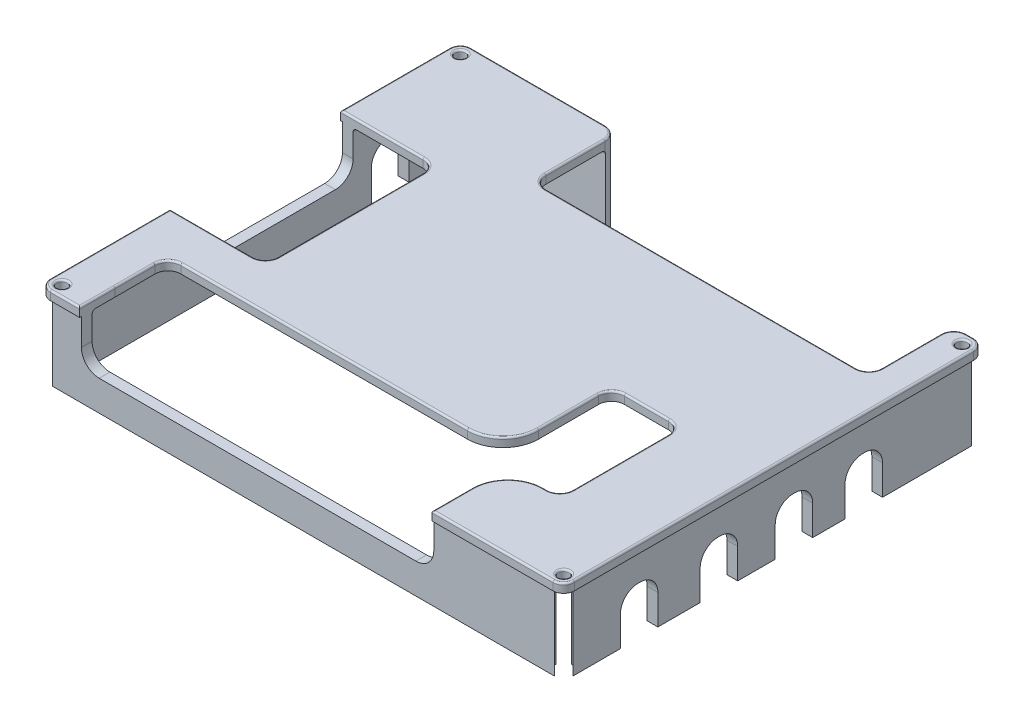
from build123d import *

# Parameters (mm, degrees)
SKETCH1_W           = 147
SKETCH1_H           = 118
BOSS_EXTRUDE1_DEPTH = 2.5
CUT_EXTRUDE1_DEPTH  = 10
BOSS_EXTRUDE2_DEPTH = 21
SKETCH6_R           = 1.4999999999999973
SKETCH6_R_2         = 1.4823605008645095
SKETCH6_R_3         = 1.484252534559789
SKETCH6_R_4         = 1.4885316900120806
CUT_EXTRUDE2_DEPTH  = 21
FILLET1_R           = 3
CUT_EXTRUDE3_DEPTH  = 3
FILLET4_R           = 4.999999999999999
SKETCH8_W           = 10.521723559696
SKETCH8_H           = 13.736523181988026
CUT_EXTRUDE4_DEPTH  = 3
FILLET5_R           = 4.999999999999999
CUT_EXTRUDE5_START  = -15
CUT_EXTRUDE5_DEPTH  = 15
FILLET6_R           = 5
FILLET7_R           = 0.5
FILLET8_R           = 1


# Read off the part's stored shape, not the designer's step: Cut-Extrude5
with BuildPart() as part:
    # Sketch1 → Boss-Extrude1 (new body)
    with BuildSketch(Plane(origin=(0, 0, 0), x_dir=(1, 0, 0), z_dir=(0, 1, 0))):
        Rectangle(SKETCH1_W, SKETCH1_H)
    extrude(amount=BOSS_EXTRUDE1_DEPTH)

    # Sketch3 → Cut-Extrude1 (cut)
    with BuildSketch(Plane(origin=(0, 2.5, 0), x_dir=(1, 0, 0), z_dir=(0, 1, 0))):
        with BuildLine():
            ThreePointArc((-32.892864533864206, 58.99999999999999), (-30.33862846902081, 57.942000780439386), (-29.280629249460205, 55.38776471559599))
            Line((-29.280629249460205, 55.38776471559599), (-29.2806292494602, 38.79021274627392))
            ThreePointArc((-29.280629249460198, 38.79021274627392), (-28.222630029899598, 36.23597668143053), (-25.668393965056207, 35.17797746186992))
            Line((-25.668393965056207, 35.17797746186992), (61.30685700718752, 35.17797746186992))
            ThreePointArc((61.30685700718752, 35.17797746186993), (63.86109307203091, 36.23597668143053), (64.91909229159151, 38.79021274627392))
            Line((64.91909229159151, 38.79021274627392), (64.91909229159151, 55.38776471559599))
            ThreePointArc((64.91909229159151, 55.38776471559599), (65.97709151115211, 57.942000780439386), (68.5313275759955, 59))
            Line((68.53132757599552, 58.99999999999999), (-32.892864533864206, 58.99999999999999))
        make_face()
        with BuildLine():
            ThreePointArc((-46.7610875562367, -18.825093847625613), (-47.81908677579731, -21.379329912468982), (-50.373322840640675, -22.437329132029586))
            Line((-50.373322840640675, -22.437329132029586), (-63.88776471559603, -22.43732913202959))
            ThreePointArc((-63.88776471559603, -22.43732913202959), (-66.44200078043941, -21.37932991246898), (-67.5, -18.825093847625592))
            Line((-67.5, -18.825093847625592), (-67.5, 21.816737731896424))
            ThreePointArc((-67.5, 21.816737731896424), (-66.4420007804394, 24.370973796739797), (-63.88776471559604, 25.42897301630042))
            Line((-63.88776471559604, 25.42897301630042), (-50.373322840640675, 25.428973016300425))
            ThreePointArc((-50.373322840640675, 25.428973016300425), (-47.8190867757973, 24.370973796739804), (-46.7610875562367, 21.816737731896424))
            Line((-46.7610875562367, 21.816737731896424), (-46.7610875562367, -18.825093847625613))
        make_face()
        with BuildLine():
            Line((35.23221749605762, -3.689694123933657), (47.5531536378178, -3.689694123933653))
            ThreePointArc((47.5531536378178, -3.689694123933653), (50.10738970266118, -4.747693343494268), (51.16538892222178, -7.301929408337653))
            Line((51.16538892222178, -7.301929408337653), (51.16538892222178, -34.12030280202387))
            ThreePointArc((51.16538892222178, -34.12030280202387), (50.10738970266135, -36.67453886686709), (47.55315363781828, -37.732538086427866))
            Line((47.55315363781828, -37.732538086427866), (46.555431638146345, -37.732538086427326))
            ThreePointArc((46.555431638146345, -37.732538086427326), (39.481945960508746, -40.66388896737662), (36.555433977376246, -47.739378012776086))
            Line((36.555433977376246, -47.739378012776086), (36.55625616412535, -48.941418085822896))
            ThreePointArc((36.55625616412535, -48.941418085822896), (35.500004270711166, -51.496377216845616), (32.9464924670362, -52.556123267571955))
            Line((32.9464924670362, -52.556123267571955), (-58.69280434770682, -52.61880388632076))
            ThreePointArc((-58.69280434770682, -52.61880388632076), (-61.24776347872955, -51.56255199290658), (-62.3075095294559, -49.00904018923161))
            Line((-62.3075095294559, -49.00904018923161), (-62.315165012113994, -37.81669618291316))
            ThreePointArc((-62.315165012113994, -37.81669618291316), (-61.25891311869982, -35.261737051890435), (-58.705401315024865, -34.201991001164075))
            Line((-58.705401315024865, -34.201991001164075), (21.626822138002403, -34.14704433912583))
            ThreePointArc((21.626822138002403, -34.14704433912583), (28.69346788929123, -31.215695797406426), (31.619982211653657, -24.14704667835571))
            Line((31.619982211653657, -24.14704667835571), (31.619982211653685, -7.301929408337654))
            ThreePointArc((31.619982211653685, -7.301929408337654), (32.67798143121427, -4.747693343494285), (35.23221749605762, -3.689694123933657))
        make_face()
    extrude(amount=-CUT_EXTRUDE1_DEPTH, mode=Mode.SUBTRACT)

    # Sketch5 → Boss-Extrude2 (add)
    with BuildSketch(Plane.XZ):
        with BuildLine():
            Line((-67.77692378864668, 55.50000000000002), (67.77692378864666, 55.50000000000002))
            ThreePointArc((67.77692378864666, 55.5), (68.39068651670148, 57.59346588560861), (70.37500000000007, 58.50000000000019))
            Line((70.37500000000007, 58.50000000000002), (-70.37499997265665, 58.50000000000001))
            ThreePointArc((-70.37499997265665, 58.50000000000007), (-68.51884468971798, 57.731155290947406), (-67.75, 55.87500000000004))
            ThreePointArc((-67.75, 55.87500000000004), (-67.7567395990083, 55.68701736091129), (-67.77692378864668, 55.50000000000006))
        make_face()
        with BuildLine():
            Line((-70.00000000000001, -53.27692378864652), (-70, 53.276923788646684))
            ThreePointArc((-70.00000000000006, 53.27692378864669), (-72.0934658856085, 53.890686516701585), (-73.00000000000006, 55.87500000000004))
            Line((-73.00000000000001, 55.87500000000004), (-72.99999999999999, -55.87499999999988))
            ThreePointArc((-73.00000000000003, -55.87499999999988), (-72.09346588560848, -53.890686516701436), (-70.00000000000006, -53.27692378864653))
        make_face()
        with BuildLine():
            ThreePointArc((72.99999999999994, 55.87500000000019), (72.0934658856084, 53.89068651670175), (69.99999999999996, 53.27692378864687))
            Line((70, 53.276923788646876), (70, -53.27692378864658))
            ThreePointArc((69.99999999999994, -53.27692378864657), (72.09346588560838, -53.89068651670145), (72.99999999999993, -55.87499999999989))
            Line((73, -55.87499999999989), (73.00000000000001, 55.87500000000019))
        make_face()
        with BuildLine():
            Line((-29.282373294319655, -55.499999999999964), (-67.77692378864663, -55.499999999999964))
            ThreePointArc((-67.77692378864664, -55.5), (-67.75673959900827, -55.687017360911184), (-67.74999999999997, -55.87499999999988))
            ThreePointArc((-67.74999999999997, -55.87499999999988), (-68.5188446993853, -57.73115530061459), (-70.375, -58.49999999999991))
            Line((-70.375, -58.499999999999986), (-31.059224633446632, -58.49999999999998))
            ThreePointArc((-31.059224633446615, -58.50000000000004), (-29.78486823925952, -57.22858050828593), (-29.282373294319648, -55.50000000000002))
        make_face()
        with BuildLine():
            ThreePointArc((70.37499999999991, -58.49999999999989), (68.39068651670149, -57.593465885608346), (67.7769237886466, -55.49999999999994))
            Line((67.7769237886466, -55.499999999999964), (64.92083633645096, -55.499999999999964))
            ThreePointArc((64.92083633645095, -55.50000000000002), (65.42333128139083, -57.22858050828592), (66.69768767557792, -58.500000000000036))
            Line((66.69768767557794, -58.49999999999997), (70.37499999999991, -58.49999999999997))
        make_face()
    extrude(amount=BOSS_EXTRUDE2_DEPTH)

    # Sketch6 → Cut-Extrude2 (cut)
    with BuildSketch(Plane(origin=(0, 2.5, 0), x_dir=(1, 0, 0), z_dir=(0, 1, 0))):
        with Locations(Location((70.37499999999949, 55.87500000000038, 0), (0, 0, 270))):
            Circle(SKETCH6_R)
        with Locations(Location((-70.37500000000044, 55.87500000000036, 0), (0, 0, 270))):
            Circle(SKETCH6_R_2)
        with Locations(Location((-70.37500000000047, -55.87499999999959, 0), (0, 0, 270))):
            Circle(SKETCH6_R_3)
        with Locations(Location((70.37499999999943, -55.874999999999666, 0), (0, 0, 270))):
            Circle(SKETCH6_R_4)
    extrude(amount=-CUT_EXTRUDE2_DEPTH, mode=Mode.SUBTRACT)

    # Fillet1
    fillet1_edges = [part.edges().sort_by_distance(p)[0] for p in [
        (73.49999999999999, 1.25, 59.000000000000014),
        (-73.50000000000001, 1.25, 59.000000000000014),
        (-73.50000000000001, 1.25, -58.99999999999999),
        (73.49999999999999, 1.25, -58.99999999999999),
    ]]
    fillet(fillet1_edges, radius=FILLET1_R)

    # Sketch7 → Cut-Extrude3 (cut)
    with BuildSketch(Plane(origin=(73, 0, -8.66e-15), x_dir=(-1.2e-16, 0, -1), z_dir=(1, 0, -1.2e-16))):
        Polygon((-42.59267980525678, -21), (-32.070956245560794, -21), (-32.070956245560794, -7.599100826531567), (-42.592679805256786, -7.599100826531567), align=None)
        Polygon((-20.2071080106505, -21), (-9.685384450954516, -21), (-9.68538445095451, -7.599100826531567), (-20.20710801065051, -7.599100826531567), align=None)
        Polygon((0.841229023424134, -21), (11.362952583120133, -21), (11.362952583120132, -7.599100826531567), (0.8412290234241366, -7.599100826531567), align=None)
        Polygon((20.428341210289467, -21), (30.950064769985463, -21), (30.950064769985463, -7.599100826531605), (20.428341210289467, -7.599100826531567), align=None)
    extrude(amount=-CUT_EXTRUDE3_DEPTH, mode=Mode.SUBTRACT)

    # Fillet4
    fillet4_edges = [part.edges().sort_by_distance(p)[0] for p in [
        (71.5, -7.599100826531567, 32.07095624556079),
        (71.5, -7.599100826531567, 42.59267980525678),
        (71.5, -7.599100826531567, 9.685384450954501),
        (71.5, -7.599100826531567, 20.207108010650504),
        (71.5, -7.599100826531567, -11.362952583120142),
        (71.5, -7.599100826531567, -0.8412290234241451),
        (71.5, -7.599100826531605, -30.95006476998547),
        (71.5, -7.599100826531567, -20.428341210289474),
    ]]
    fillet(fillet4_edges, radius=FILLET4_R)

    # Sketch8 → Cut-Extrude4 (cut)
    with BuildSketch(Plane.ZY.offset(73)):
        with Locations((-35.807787692210304, -14.131738409005987)):
            Rectangle(SKETCH8_W, SKETCH8_H)
    extrude(amount=-CUT_EXTRUDE4_DEPTH, mode=Mode.SUBTRACT)

    # Fillet5
    fillet5_edges = [part.edges().sort_by_distance(p)[0] for p in [
        (-71.49999999999999, -7.263476818011972, -30.546925912362322),
        (-71.49999999999999, -7.263476818011972, -41.06864947205832),
    ]]
    fillet(fillet5_edges, radius=FILLET5_R)

    # Cut-Extrude5 outline → Cut-Extrude5 (cut)
    with BuildSketch(Plane(origin=(0, 2.5, 0), x_dir=(1, 0, 0), z_dir=(0, 1, 0)).offset(CUT_EXTRUDE5_START)):
        with BuildLine():
            Line((-73.5, 25.428973016), (-73.5, -22.437329132))
            Line((-73.5, -22.437329132), (-63.887764716, -22.437329132))
            ThreePointArc((-63.887764716, -22.437329132), (-66.44200078, -21.379329912), (-67.5, -18.825093848))
            Line((-67.5, -18.825093848), (-67.5, 21.816737732))
            ThreePointArc((-67.5, 21.816737732), (-66.44200078, 24.370973796), (-63.887764716, 25.428973016))
            Line((-63.887764716, 25.428973016), (-73.5, 25.428973016))
        make_face()
        with BuildLine():
            ThreePointArc((36.556257009, -48.943888828), (35.49913118, -51.497251205), (32.946492467, -52.556123268))
            Line((32.946492467, -52.556123268), (-58.692804348, -52.618803886))
            ThreePointArc((-58.692804348, -52.618803886), (-61.247763479, -51.562551993), (-62.307509529, -49.009040189))
            Line((-62.307509529, -49.009040189), (-62.307509529, -59))
            Line((-62.307509529, -59), (36.556256164, -59))
            Line((36.556256164, -59), (36.556257009, -48.943888828))
        make_face()
    extrude(amount=CUT_EXTRUDE5_DEPTH, mode=Mode.SUBTRACT)

    # Fillet6
    fillet6_edges = [part.edges().sort_by_distance(p)[0] for p in [
        (36.55625633205701, -12.5, 57.00000000000002),
        (-62.307509529, -12.5, 57.000000000000014),
        (-71.5, -12.5, 22.437329132),
        (-71.5, -12.5, -25.428973016),
    ]]
    fillet(fillet6_edges, radius=FILLET6_R)

    # Fillet7
    fillet7_edges = [part.edges().sort_by_distance(p)[0] for p in [
        (-47.81908677579731, 2.5, 21.37932991246898),
        (-57.13054377811836, 2.5, -25.428973016300425),
        (-46.7610875562367, 2.5, -1.4958219421354073),
        (-47.8190867757973, 2.5, -24.370973796739804),
        (-57.13054377811835, 2.5, 22.43732913202959),
        (70.37499999999943, 2.5, 54.386468309987585),
        (-70.37500000000047, 2.5, 54.3907474654398),
        (-70.37500000000044, 2.5, -57.35736050086487),
        (70.37499999999949, 2.5, -57.37500000000038),
        (-73.50000000000001, 2.5, -40.71448650799999),
        (-66.40375476450001, 2.5, 59.000000000000014),
        (73.49999999999999, 2.5, 1.421e-14),
        (69.51566378799774, 2.5, -58.99999999999999),
        (72.62132034355963, 2.5, -58.12132034355963),
        (72.62132034355963, 2.5, 58.12132034355966),
        (-72.62132034355966, 2.5, 58.12132034355966),
        (-72.62132034355966, 2.5, -58.12132034355964),
        (-51.696432266932106, 2.5, -58.99999999999999),
        (36.55625679786397, 2.5, 48.9426534568392),
        (53.528128081999995, 2.5, 59.000000000000014),
        (-73.50000000000001, 2.5, 39.21866456600001),
        (-62.307509529, 2.5, 54.004520094499995),
        (36.5562565865, 2.5, 53.971944414),
        (-30.33862846902081, 2.5, -57.942000780439386),
        (65.97709151115211, 2.5, -57.942000780439386),
        (-29.280629249460205, 2.5, -47.08898873093496),
        (-28.222630029899598, 2.5, -36.23597668143053),
        (17.819231521065657, 2.5, -35.17797746186992),
        (63.86109307203091, 2.5, -36.23597668143053),
        (64.91909229159151, 2.5, -47.08898873093496),
        (41.392685566937715, 2.5, 3.6896941239336547),
        (51.16538892222178, 2.5, 20.711116105180764),
        (50.10738970266135, 2.5, 36.67453886686709),
        (39.48194596050876, 2.5, 40.66388896737661),
        (36.5558450707508, 2.5, 48.340398049299495),
        (-61.25891311869982, 2.5, 35.261737051890435),
        (-18.53928958851123, 2.5, 34.17451767014495),
        (32.67798143121427, 2.5, 4.747693343494285),
        (31.61998221165367, 2.5, 15.724488043346682),
        (28.693467889291227, 2.5, 31.215695797406426),
        (-62.311337270784946, 2.5, 43.41286818607239),
        (47.054292637982314, 2.5, 37.732538086427596),
        (50.10738970266118, 2.5, 4.747693343494268),
    ]]
    fillet(fillet7_edges, radius=FILLET7_R)

    # Fillet8
    fillet8_edges = [part.edges().sort_by_distance(p)[0] for p in [
        (-48.52964854148314, 0, -55.499999999999964),
        (-70.00000000000001, 0, -39.352948402323264),
        (-65.04221665882335, 0, 55.50000000000002),
        (-70, 0, 37.857126460323336),
        (52.16659012337321, 0, 55.50000000000002),
        (70, 0, 1.4921e-13),
    ]]
    fillet(fillet8_edges, radius=FILLET8_R)


solid = part.part
